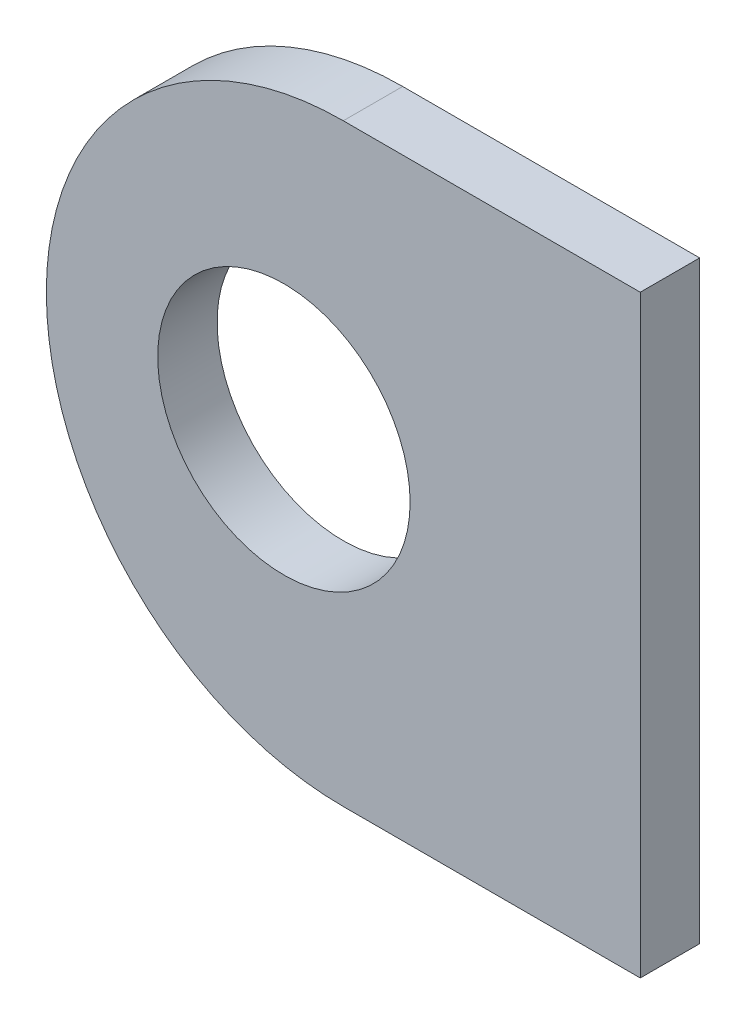
from build123d import *

# Parameters (mm, degrees)
SKETCH2_W           = 20
SKETCH2_H           = 20
BOSS_EXTRUDE1_DEPTH = 2
SKETCH3_R           = 4.25
CUT_EXTRUDE1_DEPTH  = 15.282856857
FILLET1_R           = 10


with BuildPart() as part:
    # Sketch2 → Boss-Extrude1 (new body)
    with BuildSketch(Plane.XY):
        Rectangle(SKETCH2_W, SKETCH2_H)
    extrude(amount=BOSS_EXTRUDE1_DEPTH)

    # Sketch3 → Cut-Extrude1 (cut, through all)
    with BuildSketch(Plane.XY.offset(2)):
        with Locations((-2, 0)):
            Circle(SKETCH3_R)
    extrude(amount=-CUT_EXTRUDE1_DEPTH, mode=Mode.SUBTRACT)

    # Fillet1
    fillet1_edges = [part.edges().sort_by_distance(p)[0] for p in [
        (-10, -10, 1),
        (-10, 10, 1),
    ]]
    fillet(fillet1_edges, radius=FILLET1_R - 0.0001)  # a hair under: the kernel refuses the full size


solid = part.part
